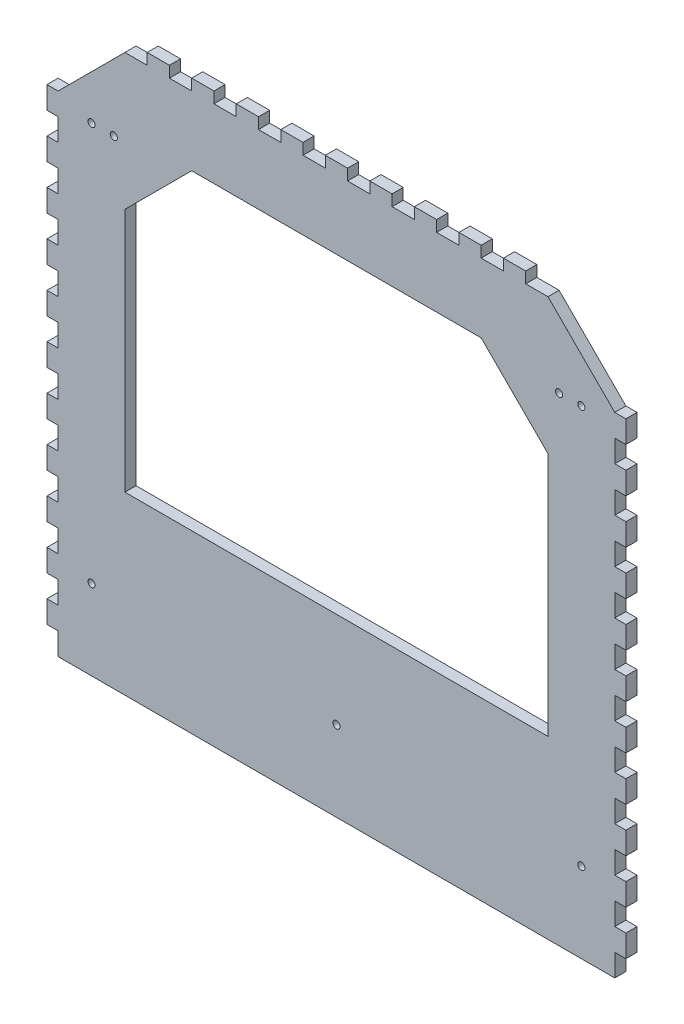
from build123d import *

# Parameters (mm, degrees)
SKIZZE1_R                       = 1.6
AUFSATZ_LINEAR_AUSTRAGEN2_DEPTH = 5


with BuildPart() as part:
    # Skizze1 → Aufsatz-Linear austragen2 (new body)
    with BuildSketch(Plane.XY):
        Polygon((35, 250), (45, 250), (45, 255), (55, 255), (55, 250), (65, 250), (65, 255), (75, 255), (75, 250), (85, 250), (85, 255), (95, 255), (95, 250), (105, 250), (105, 255), (115, 255), (115, 250), (125, 250), (125, 255), (135, 255), (135, 250), (145, 250), (145, 255), (155, 255), (155, 250), (165, 250), (165, 255), (175, 255), (175, 250), (185, 250), (185, 255), (195, 255), (195, 250), (205, 250), (205, 255), (215, 255), (215, 250), (225, 250), (255, 220), (260, 220), (260, 210), (255, 210), (255, 200), (260, 200), (260, 190), (255, 190), (255, 180), (260, 180), (260, 170), (255, 170), (255, 160), (260, 160), (260, 150), (255, 150), (255, 140), (260, 140), (260, 130), (255, 130), (255, 120), (260, 120), (260, 110), (255, 110), (255, 100), (260, 100), (260, 90), (255, 90), (255, 80), (260, 80), (260, 70), (255, 70), (255, 60), (260, 60), (260, 50), (255, 50), (255, 40), (260, 40), (260, 30), (255, 30), (255, 20), (260, 20), (260, 10), (255, 10), (255, 0), (5, 0), (5, 10), (0, 10), (0, 20), (5, 20), (5, 30), (0, 30), (0, 40), (5, 40), (5, 50), (0, 50), (0, 60), (5, 60), (5, 70), (0, 70), (0, 80), (5, 80), (5, 90), (0, 90), (0, 100), (5, 100), (5, 110), (0, 110), (0, 120), (5, 120), (5, 130), (0, 130), (0, 140), (5, 140), (5, 150), (0, 150), (0, 160), (5, 160), (5, 170), (0, 170), (0, 180), (5, 180), (5, 190), (0, 190), (0, 200), (5, 200), (5, 210), (0, 210), (0, 220), (5, 220), align=None)
        with Locations((20, 215)):
            Circle(SKIZZE1_R, mode=Mode.SUBTRACT)
        with Locations((30, 215)):
            Circle(SKIZZE1_R, mode=Mode.SUBTRACT)
        with Locations((240, 215)):
            Circle(SKIZZE1_R, mode=Mode.SUBTRACT)
        with Locations((230, 215)):
            Circle(SKIZZE1_R, mode=Mode.SUBTRACT)
        with Locations((20, 36)):
            Circle(SKIZZE1_R, mode=Mode.SUBTRACT)
        with Locations((130, 36)):
            Circle(SKIZZE1_R, mode=Mode.SUBTRACT)
        with Locations((240, 36)):
            Circle(SKIZZE1_R, mode=Mode.SUBTRACT)
        Polygon((65, 218.971165398), (195, 218.971165398), (225, 188.971165398), (225, 78.971165398), (35, 78.971165398), (35, 188.971165398), align=None, mode=Mode.SUBTRACT)
    extrude(amount=AUFSATZ_LINEAR_AUSTRAGEN2_DEPTH)


solid = part.part
